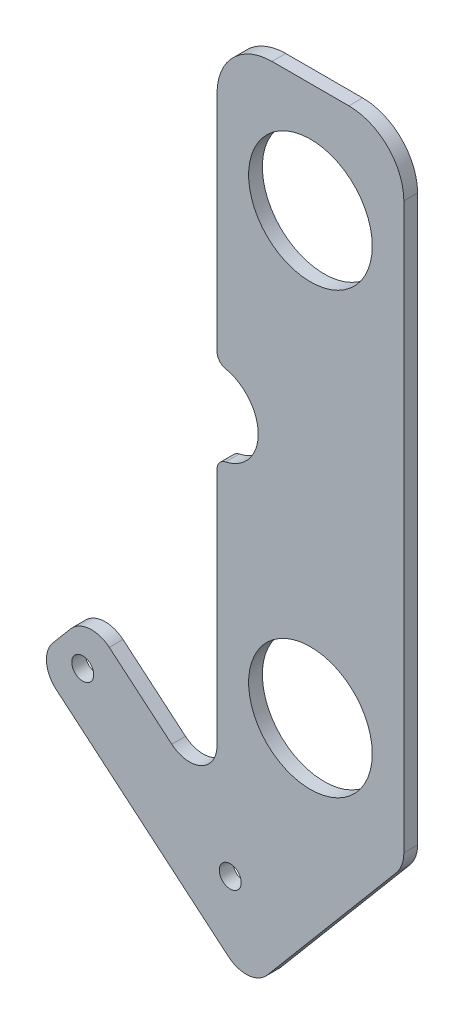
from build123d import *

# Parameters (mm, degrees)
SKETCH1_R           = 14.2875
SKETCH1_R_2         = 2.54
BOSS_EXTRUDE1_DEPTH = 3.175
CUT_EXTRUDE1_DEPTH  = 162.674043733
FILLET1_R           = 2.54
BOSS_EXTRUDE3_START = -3.175
SKETCH3_R           = 2.54
BOSS_EXTRUDE3_DEPTH = 3.175
SKETCH6_R           = 2.54
BOSS_EXTRUDE4_DEPTH = 3.175
FILLET2_R           = 6.35


with BuildPart() as part:
    # Sketch1 → Boss-Extrude1 (new body)
    with BuildSketch(Plane.XY):
        with BuildLine():
            Line((-8.89, 25.4), (8.89, 25.4))
            ThreePointArc((8.89, 25.4), (17.870256121, 21.680256121), (21.59, 12.7))
            Line((21.59, 12.7), (21.59, -117.775079775))
            ThreePointArc((21.59, -117.775079775), (21.127743647, -120.388718212), (19.797058824, -122.685251408))
            Line((19.797058824, -122.685251408), (-7.952696208, -155.616779465))
            ThreePointArc((-7.952696208, -155.616779465), (-12.268297602, -157.851943494), (-16.900388255, -156.380852124))
            Line((-16.900388255, -156.380852124), (-32.439211784, -143.287061102))
            ThreePointArc((-32.439211784, -143.287061102), (-34.674375812, -138.971459708), (-33.203284443, -134.339369055))
            Line((-33.203284443, -134.339369055), (-23.382941176, -122.685251408))
            ThreePointArc((-23.382941176, -122.685251408), (-22.052256353, -120.388718212), (-21.59, -117.775079775))
            Line((-21.59, -117.775079775), (-21.59, 12.7))
            ThreePointArc((-21.59, 12.7), (-17.870256121, 21.680256121), (-8.89, 25.4))
        make_face()
        Circle(SKETCH1_R, mode=Mode.SUBTRACT)
        with Locations((0, -101.6)):
            Circle(SKETCH1_R, mode=Mode.SUBTRACT)
        with Locations((-18.532085478, -142.550133084)):
            Circle(SKETCH1_R_2, mode=Mode.SUBTRACT)
    extrude(amount=BOSS_EXTRUDE1_DEPTH)

    # Sketch2 → Cut-Extrude1 (cut, through all)
    with BuildSketch(Plane.XY):
        with BuildLine():
            ThreePointArc((-21.59, -60.325), (-12.065, -50.8), (-21.59, -41.275))
            Line((-21.59, -41.275), (-21.59, -60.325))
        make_face()
    extrude(amount=CUT_EXTRUDE1_DEPTH, mode=Mode.SUBTRACT)

    # Fillet1
    fillet1_edges = [part.edges().sort_by_distance(p)[0] for p in [
        (-21.59, -60.325, 1.5875),
        (-21.59, -41.275, 1.5875),
    ]]
    fillet(fillet1_edges, radius=FILLET1_R)

    # Sketch3 → Boss-Extrude3 (add)
    with BuildSketch(Plane.XY.offset(3.175).offset(BOSS_EXTRUDE3_START)):
        with BuildLine():
            Line((-22.973760207, -122.199663173), (-35.24918929, -136.767310231))
            ThreePointArc((-35.24918929, -136.767310231), (-36.72028066, -141.399400884), (-34.485116631, -145.715002279))
            Line((-34.485116631, -145.715002279), (-18.946293102, -158.808793301))
            ThreePointArc((-18.946293102, -158.808793301), (-14.314202449, -160.27988467), (-9.998601055, -158.044720642))
            Line((-9.998601055, -158.044720642), (2.276828028, -143.477073583))
            Line((2.276828028, -143.477073583), (-22.973760207, -122.199663173))
        make_face()
        with Locations((-18.532085478, -142.550133084)):
            Circle(SKETCH3_R, mode=Mode.SUBTRACT)
    extrude(amount=BOSS_EXTRUDE3_DEPTH)

    # Sketch6 → Boss-Extrude4 (add)
    with BuildSketch(Plane.XY.offset(3.175)):
        Polygon((-34.485116631, -145.715002279), (-63.620410749, -121.164144113), (-51.344981666, -106.596497054), (-27.065569901, -127.055545526), align=None)
        with Locations((-52.626813855, -117.972130278)):
            Circle(SKETCH6_R, mode=Mode.SUBTRACT)
    extrude(amount=-BOSS_EXTRUDE4_DEPTH)

    # Fillet2
    fillet2_edges = [part.edges().sort_by_distance(p)[0] for p in [
        (-63.620410749, -121.164144113, 1.5875),
        (-51.344981666, -106.596497054, 1.5875),
        (-27.065569901, -127.055545526, 1.5875),
    ]]
    fillet(fillet2_edges, radius=FILLET2_R)


solid = part.part
